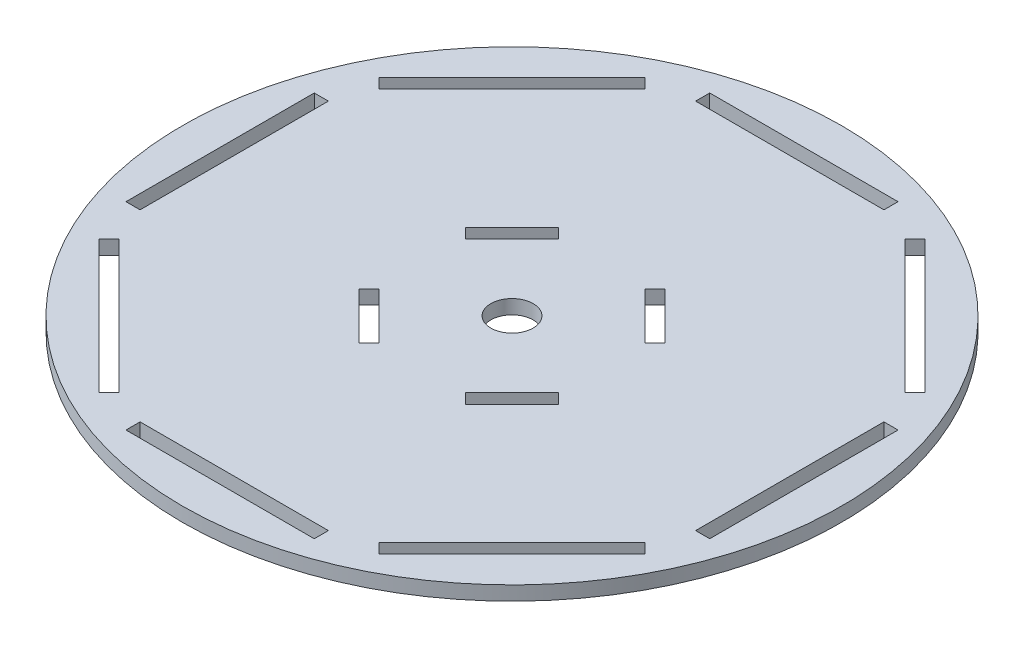
from build123d import *

# Parameters (mm, degrees)
CROQUIS1_R              = 70
CROQUIS1_R_2            = 4.5
SALIENTE_EXTRUIR1_DEPTH = 3


with BuildPart() as part:
    # Croquis1 → Saliente-Extruir1 (new body)
    with BuildSketch(Plane(origin=(0, 0, 0), x_dir=(1, 0, 0), z_dir=(0, 1, 0))):
        Circle(CROQUIS1_R)
        Circle(CROQUIS1_R_2, mode=Mode.SUBTRACT)
        Polygon((-14.142135624, 14.142135624), (-9.192388155, 19.091883092), (-11.313708499, 21.213203436), (-21.213203436, 11.313708499), (-19.091883092, 9.192388155), align=None, mode=Mode.SUBTRACT)
        Polygon((21.213203436, 11.313708499), (11.313708499, 21.213203436), (9.192388155, 19.091883092), (14.142135624, 14.142135624), (19.091883092, 9.192388155), align=None, mode=Mode.SUBTRACT)
        Polygon((11.313708499, -21.213203436), (21.213203436, -11.313708499), (19.091883092, -9.192388155), (14.142135624, -14.142135624), (9.192388155, -19.091883092), align=None, mode=Mode.SUBTRACT)
        Polygon((-21.213203436, -11.313708499), (-11.313708499, -21.213203436), (-9.192388155, -19.091883092), (-14.142135624, -14.142135624), (-19.091883092, -9.192388155), align=None, mode=Mode.SUBTRACT)
        Polygon((0, 62), (20, 62), (20, 59), (-20, 59), (-20, 62), align=None, mode=Mode.SUBTRACT)
        Polygon((55.861435714, 27.577164466), (27.577164466, 55.861435714), (29.69848481, 57.982756057), (43.840620434, 43.840620434), (57.982756057, 29.69848481), align=None, mode=Mode.SUBTRACT)
        Polygon((59, -20), (59, 20), (62, 20), (62, 0), (62, -20), align=None, mode=Mode.SUBTRACT)
        Polygon((27.577164466, -55.861435714), (55.861435714, -27.577164466), (57.982756057, -29.69848481), (43.840620434, -43.840620434), (29.69848481, -57.982756057), align=None, mode=Mode.SUBTRACT)
        Polygon((-20, -59), (20, -59), (20, -62), (0, -62), (-20, -62), align=None, mode=Mode.SUBTRACT)
        Polygon((-55.861435714, -27.577164466), (-27.577164466, -55.861435714), (-29.69848481, -57.982756057), (-43.840620434, -43.840620434), (-57.982756057, -29.69848481), align=None, mode=Mode.SUBTRACT)
        Polygon((-59, 20), (-59, -20), (-62, -20), (-62, 0), (-62, 20), align=None, mode=Mode.SUBTRACT)
        Polygon((-27.577164466, 55.861435714), (-55.861435714, 27.577164466), (-57.982756057, 29.69848481), (-43.840620434, 43.840620434), (-29.69848481, 57.982756057), align=None, mode=Mode.SUBTRACT)
    extrude(amount=SALIENTE_EXTRUIR1_DEPTH)


solid = part.part
